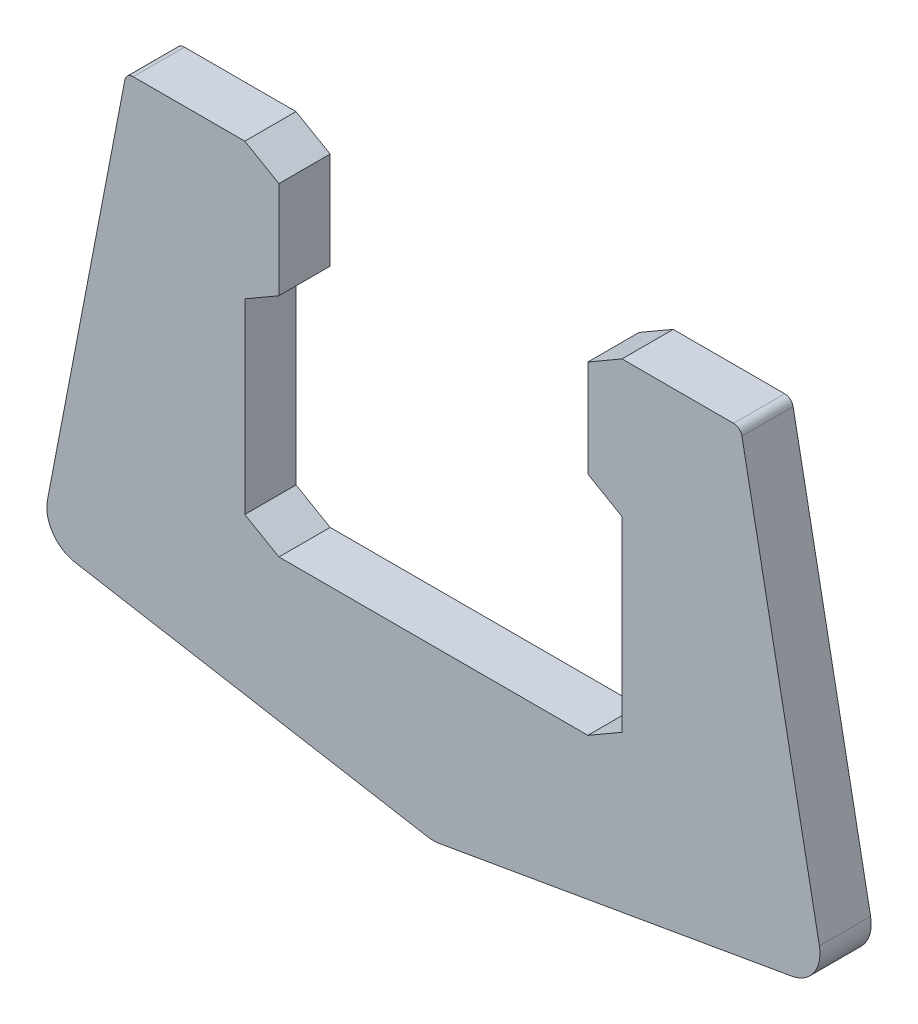
from build123d import *

# Parameters (mm, degrees)
EXTRUDE_1_DEPTH = 1.5
FILLET_1_R      = 2
FILLET_2_R      = 0.5


with BuildPart() as part:
    # 草图1 → 凸台-拉伸1 (new, symmetric)
    with BuildSketch(Plane.XY):
        Polygon((0, -30), (-23, -26), (-18, 0), (-11.05, 0), (-9.05, -1.154700538), (-9.05, -6.845299462), (-11.05, -8), (-11.05, -18.945299462), (-9.05, -20.1), (9.05, -20.1), (11.05, -18.945299462), (11.05, -8), (9.05, -6.845299462), (9.05, -1.154700538), (11.05, 0), (18, 0), (23, -26), align=None)
    extrude(amount=EXTRUDE_1_DEPTH, both=True)

    # 圆角1
    fillet_1_edges = [part.edges().sort_by_distance(p)[0] for p in [
        (23, -26, 0),
        (0, -30, 0),
        (-23, -26, 0),
    ]]
    fillet(fillet_1_edges, radius=FILLET_1_R)

    # 圆角2
    fillet_2_edges = [part.edges().sort_by_distance(p)[0] for p in [
        (-18, 0, 0),
        (18, 0, 0),
    ]]
    fillet(fillet_2_edges, radius=FILLET_2_R)


solid = part.part
